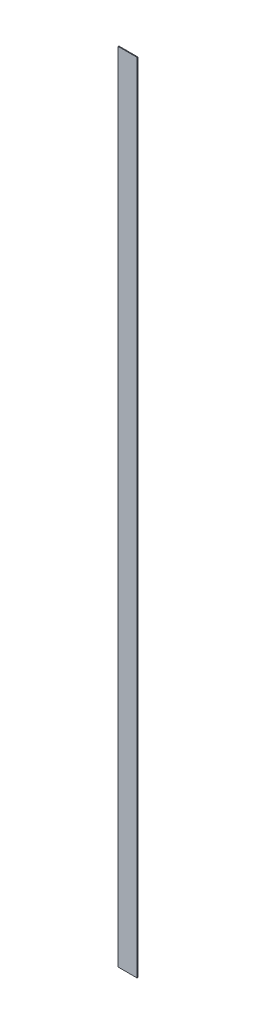
from build123d import *

# Parameters (mm, degrees)
SKETCH_1_W                   = 9.5
SKETCH_1_H                   = 399.96
EXTRUDE_1_DEPTH              = 0.38
SKETCH_2_W                   = 5
SKETCH_2_H                   = 5
EXTRUDE_2_DEPTH              = 1.7
SKETCH_3_R                   = 1.75
CUT_EXTRUDE_1_DEPTH          = 0.5
SKETCH_4_R                   = 1.6
EXTRUDE_3_DEPTH              = 0.3
PATTERN_START                = -1.2
PATTERN_LINEAR_2_OUTLINE_W   = 5
PATTERN_LINEAR_2_OUTLINE_H   = 5
PATTERN_LINEAR_2_DEPTH       = 1.2
PATTERN_START_2              = -1.7
PATTERN_LINEAR_2_2_OUTLINE_W = 5
PATTERN_LINEAR_2_2_OUTLINE_H = 5
PATTERN_LINEAR_2_2_OUTLINE_R = 1.75
PATTERN_LINEAR_2_2_DEPTH     = 0.5


# Read off the part's stored shape, not the designer's step: 阵列(线性)2
with BuildPart() as part:
    # 草图1 → 凸台-拉伸1 (new body)
    with BuildSketch(Plane.XY):
        Rectangle(SKETCH_1_W, SKETCH_1_H)
    extrude(amount=EXTRUDE_1_DEPTH)

    # 草图2 → 凸台-拉伸2 (add)
    with BuildSketch(Plane(origin=(0, 0, 0), x_dir=(-1, 0, 0), z_dir=(0, 0, -1))):
        with Locations((0, 183.315)):
            Rectangle(SKETCH_2_W, SKETCH_2_H)
    extrude(amount=EXTRUDE_2_DEPTH)

    # 草图3 → 切除-拉伸1 (cut)
    with BuildSketch(Plane(origin=(0, 0, -1.7), x_dir=(-1, 0, 0), z_dir=(0, 0, -1))):
        with Locations((0, 183.315)):
            Circle(SKETCH_3_R)
    extrude(amount=-CUT_EXTRUDE_1_DEPTH, mode=Mode.SUBTRACT)

    # 阵列(线性)2 outline → 阵列(线性)2 (add)
    with BuildSketch(Plane.XY.offset(PATTERN_START)):
        with Locations((0, 149.985)):
            Rectangle(PATTERN_LINEAR_2_OUTLINE_W, PATTERN_LINEAR_2_OUTLINE_H)
        with Locations((0, 116.655)):
            Rectangle(PATTERN_LINEAR_2_OUTLINE_W, PATTERN_LINEAR_2_OUTLINE_H)
        with Locations((0, 83.325)):
            Rectangle(PATTERN_LINEAR_2_OUTLINE_W, PATTERN_LINEAR_2_OUTLINE_H)
        with Locations((0, 49.995)):
            Rectangle(PATTERN_LINEAR_2_OUTLINE_W, PATTERN_LINEAR_2_OUTLINE_H)
        with Locations((0, 16.665)):
            Rectangle(PATTERN_LINEAR_2_OUTLINE_W, PATTERN_LINEAR_2_OUTLINE_H)
        with Locations((0, -16.665)):
            Rectangle(PATTERN_LINEAR_2_OUTLINE_W, PATTERN_LINEAR_2_OUTLINE_H)
        with Locations((0, -49.995)):
            Rectangle(PATTERN_LINEAR_2_OUTLINE_W, PATTERN_LINEAR_2_OUTLINE_H)
        with Locations((0, -83.325)):
            Rectangle(PATTERN_LINEAR_2_OUTLINE_W, PATTERN_LINEAR_2_OUTLINE_H)
        with Locations((0, -116.655)):
            Rectangle(PATTERN_LINEAR_2_OUTLINE_W, PATTERN_LINEAR_2_OUTLINE_H)
        with Locations((0, -149.985)):
            Rectangle(PATTERN_LINEAR_2_OUTLINE_W, PATTERN_LINEAR_2_OUTLINE_H)
        with Locations((0, -183.315)):
            Rectangle(PATTERN_LINEAR_2_OUTLINE_W, PATTERN_LINEAR_2_OUTLINE_H)
    extrude(amount=PATTERN_LINEAR_2_DEPTH)

    # Pattern Linear 2 2 outline → Pattern Linear 2 2 (add)
    # profile 1 of 11: a face of its own
    with BuildSketch(Plane.XY.offset(PATTERN_START_2)):
        with Locations((0, 149.985)):
            Rectangle(PATTERN_LINEAR_2_2_OUTLINE_W, PATTERN_LINEAR_2_2_OUTLINE_H)
        with Locations((0, 149.985)):
            Circle(PATTERN_LINEAR_2_2_OUTLINE_R, mode=Mode.SUBTRACT)
    # profile 2 of 11: a face of its own
    with BuildSketch(Plane.XY.offset(PATTERN_START_2)):
        with Locations((0, 116.655)):
            Rectangle(PATTERN_LINEAR_2_2_OUTLINE_W, PATTERN_LINEAR_2_2_OUTLINE_H)
        with Locations((0, 116.655)):
            Circle(PATTERN_LINEAR_2_2_OUTLINE_R, mode=Mode.SUBTRACT)
    # profile 3 of 11: a face of its own
    with BuildSketch(Plane.XY.offset(PATTERN_START_2)):
        with Locations((0, 83.325)):
            Rectangle(PATTERN_LINEAR_2_2_OUTLINE_W, PATTERN_LINEAR_2_2_OUTLINE_H)
        with Locations((0, 83.325)):
            Circle(PATTERN_LINEAR_2_2_OUTLINE_R, mode=Mode.SUBTRACT)
    # profile 4 of 11: a face of its own
    with BuildSketch(Plane.XY.offset(PATTERN_START_2)):
        with Locations((0, 49.995)):
            Rectangle(PATTERN_LINEAR_2_2_OUTLINE_W, PATTERN_LINEAR_2_2_OUTLINE_H)
        with Locations((0, 49.995)):
            Circle(PATTERN_LINEAR_2_2_OUTLINE_R, mode=Mode.SUBTRACT)
    # profile 5 of 11: a face of its own
    with BuildSketch(Plane.XY.offset(PATTERN_START_2)):
        with Locations((0, 16.665)):
            Rectangle(PATTERN_LINEAR_2_2_OUTLINE_W, PATTERN_LINEAR_2_2_OUTLINE_H)
        with Locations((0, 16.665)):
            Circle(PATTERN_LINEAR_2_2_OUTLINE_R, mode=Mode.SUBTRACT)
    # profile 6 of 11: a face of its own
    with BuildSketch(Plane.XY.offset(PATTERN_START_2)):
        with Locations((0, -16.665)):
            Rectangle(PATTERN_LINEAR_2_2_OUTLINE_W, PATTERN_LINEAR_2_2_OUTLINE_H)
        with Locations((0, -16.665)):
            Circle(PATTERN_LINEAR_2_2_OUTLINE_R, mode=Mode.SUBTRACT)
    # profile 7 of 11: a face of its own
    with BuildSketch(Plane.XY.offset(PATTERN_START_2)):
        with Locations((0, -49.995)):
            Rectangle(PATTERN_LINEAR_2_2_OUTLINE_W, PATTERN_LINEAR_2_2_OUTLINE_H)
        with Locations((0, -49.995)):
            Circle(PATTERN_LINEAR_2_2_OUTLINE_R, mode=Mode.SUBTRACT)
    # profile 8 of 11: a face of its own
    with BuildSketch(Plane.XY.offset(PATTERN_START_2)):
        with Locations((0, -83.325)):
            Rectangle(PATTERN_LINEAR_2_2_OUTLINE_W, PATTERN_LINEAR_2_2_OUTLINE_H)
        with Locations((0, -83.325)):
            Circle(PATTERN_LINEAR_2_2_OUTLINE_R, mode=Mode.SUBTRACT)
    # profile 9 of 11: a face of its own
    with BuildSketch(Plane.XY.offset(PATTERN_START_2)):
        with Locations((0, -116.655)):
            Rectangle(PATTERN_LINEAR_2_2_OUTLINE_W, PATTERN_LINEAR_2_2_OUTLINE_H)
        with Locations((0, -116.655)):
            Circle(PATTERN_LINEAR_2_2_OUTLINE_R, mode=Mode.SUBTRACT)
    # profile 10 of 11: a face of its own
    with BuildSketch(Plane.XY.offset(PATTERN_START_2)):
        with Locations((0, -149.985)):
            Rectangle(PATTERN_LINEAR_2_2_OUTLINE_W, PATTERN_LINEAR_2_2_OUTLINE_H)
        with Locations((0, -149.985)):
            Circle(PATTERN_LINEAR_2_2_OUTLINE_R, mode=Mode.SUBTRACT)
    # profile 11 of 11: a face of its own
    with BuildSketch(Plane.XY.offset(PATTERN_START_2)):
        with Locations((0, -183.315)):
            Rectangle(PATTERN_LINEAR_2_2_OUTLINE_W, PATTERN_LINEAR_2_2_OUTLINE_H)
        with Locations((0, -183.315)):
            Circle(PATTERN_LINEAR_2_2_OUTLINE_R, mode=Mode.SUBTRACT)
    extrude(amount=PATTERN_LINEAR_2_2_DEPTH)


with BuildPart() as body_2:
    # 草图4 → 凸台-拉伸3 (new body)
    with BuildSketch(Plane(origin=(0, 0, -1.7), x_dir=(-1, 0, 0), z_dir=(0, 0, -1))):
        with Locations((0, 183.315)):
            Circle(SKETCH_4_R)
    extrude(amount=-EXTRUDE_3_DEPTH)


solid = Compound([part.part, body_2.part])
